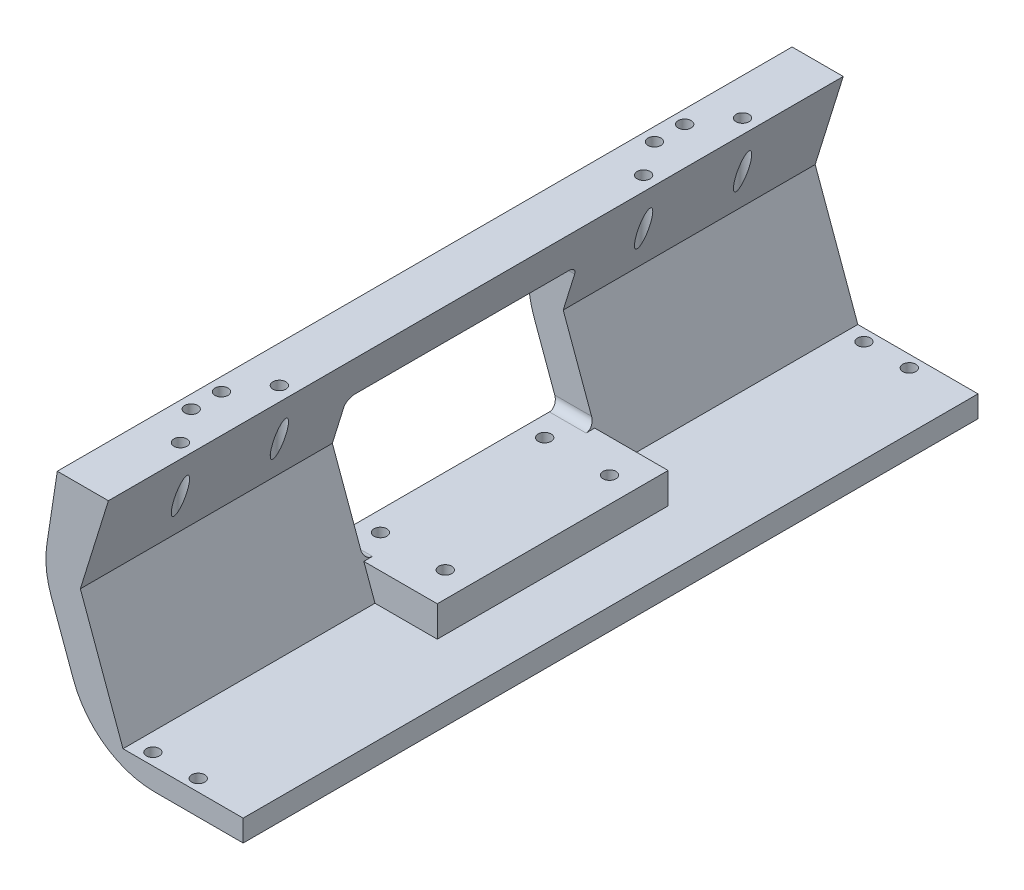
from build123d import *

# Parameters (mm, degrees)
SKETCH_1_W          = 27.799055089
SKETCH_1_H          = 170
SKETCH_1_R          = 1.5
EXTRUDE_1_DEPTH     = 5
EXTRUDE_2_DEPTH     = 170
FILLET_1_R          = 20
FILLET_2_R          = 20
SKETCH_3_R          = 1.5
CUT_EXTRUDE_1_DEPTH = 22
SKETCH_5_W          = 53.411136204
SKETCH_5_H          = 30.531921538
CUT_EXTRUDE_2_DEPTH = 138
SKETCH_6_W          = 16.9901426
SKETCH_6_H          = 53.411136204
EXTRUDE_3_DEPTH     = 7.098148729
FILLET_3_R          = 2
SKETCH_7_R          = 1.5
CUT_EXTRUDE_3_DEPTH = 20


with BuildPart() as part:
    # 草图1 → 凸台-拉伸1 (new body)
    with BuildSketch(Plane(origin=(0, 0, 0), x_dir=(1, 0, 0), z_dir=(0, 1, 0))):
        with Locations((91.881203353, 5)):
            Rectangle(SKETCH_1_W, SKETCH_1_H)
        with Locations(Location((82.140918425, 87.25, 0), (0, 0, 270))):
            Circle(SKETCH_1_R, mode=Mode.SUBTRACT)
        with Locations(Location((92.640918425, 87.25, 0), (0, 0, 270))):
            Circle(SKETCH_1_R, mode=Mode.SUBTRACT)
        with Locations(Location((82.140918425, -77.25, 0), (0, 0, 270))):
            Circle(SKETCH_1_R, mode=Mode.SUBTRACT)
        with Locations(Location((92.640918425, -77.25, 0), (0, 0, 270))):
            Circle(SKETCH_1_R, mode=Mode.SUBTRACT)
    extrude(amount=EXTRUDE_1_DEPTH)

    # 草图2 → 凸台-拉伸2 (add)
    with BuildSketch(Plane.XY.offset(80)):
        Polygon((70.154089187, 3.11568229), (59.601778844, 32.107916678), (60.432470808, 37.577633674), (62.77468262, 53), (74.6026601, 53), (68.115201024, 32.107916678), (77.981675808, 5), (77.981675808, 0), (71.288104799, 0), align=None)
    extrude(amount=-EXTRUDE_2_DEPTH)

    # 圆角1
    fillet_1_edges = [part.edges().sort_by_distance(p)[0] for p in [
        (59.601778844, 32.107916678, -5),
    ]]
    fillet(fillet_1_edges, radius=FILLET_1_R)

    # 圆角2
    # the kernel refuses this fillet: 20 mm, written as the material it takes off along each edge
    with BuildSketch(Plane(origin=(71.288104799, 0, 115.01037691), x_dir=(-0.34202014332567304, 0.9396926207859069, 0), z_dir=(0, 0, -1))) as fillet_2_piece_1:
        with BuildLine():
            CenterArc((FILLET_2_R * 0.70020753821, FILLET_2_R), FILLET_2_R, 200, 70)
            Line((-FILLET_2_R * 0.239485082576, FILLET_2_R * 0.657979856674), (0, 0))
            Line((0, 0), (FILLET_2_R * 0.70020753821, 0))
        make_face()
    extrude(amount=240.020753821, mode=Mode.SUBTRACT)

    # 草图3 → 切除-拉伸1 (cut)
    with BuildSketch(Plane(origin=(0, 53, 0), x_dir=(1, 0, 0), z_dir=(0, 1, 0))):
        with Locations(Location((71.288104799, 70.02483454, 0), (0, 0, 270))):
            Circle(SKETCH_3_R)
        with Locations(Location((65.841750728, 62.078973455, 0), (0, 0, 270))):
            Circle(SKETCH_3_R)
        with Locations(Location((65.841750728, 55.078973455, 0), (0, 0, 270))):
            Circle(SKETCH_3_R)
        with Locations(Location((71.288104799, 47.133112371, 0), (0, 0, 270))):
            Circle(SKETCH_3_R)
        with Locations(Location((71.288104799, -37.133112371, 0), (0, 0, 270))):
            Circle(SKETCH_3_R)
        with Locations(Location((65.841750728, -45.078973455, 0), (0, 0, 270))):
            Circle(SKETCH_3_R)
        with Locations(Location((65.841750728, -52.078973455, 0), (0, 0, 270))):
            Circle(SKETCH_3_R)
        with Locations(Location((71.288104799, -60.02483454, 0), (0, 0, 270))):
            Circle(SKETCH_3_R)
    extrude(amount=-CUT_EXTRUDE_1_DEPTH, mode=Mode.SUBTRACT)

    # 草图5 → 切除-拉伸2 (cut)
    with BuildSketch(Plane(origin=(0, 0, 0), x_dir=(0, 0, -1), z_dir=(1, 0, 0))):
        with Locations((5, 27.364109498)):
            Rectangle(SKETCH_5_W, SKETCH_5_H)
    extrude(amount=CUT_EXTRUDE_2_DEPTH, mode=Mode.SUBTRACT)

    # 草图6 → 凸台-拉伸3 (add)
    with BuildSketch(Plane(origin=(0, 5, 0), x_dir=(1, 0, 0), z_dir=(0, 1, 0))):
        with Locations((83.893232252, 5)):
            Rectangle(SKETCH_6_W, SKETCH_6_H)
    extrude(amount=EXTRUDE_3_DEPTH)

    # 圆角3
    fillet_3_edges = [part.edges().sort_by_distance(p)[0] for p in [
        (71.158795105, 12.098148729, -31.705568102),
        (71.158795105, 12.098148729, 21.705568102),
        (66.291177476, 42.630070267, 21.705568102),
        (66.291177476, 42.630070267, -31.705568102),
    ]]
    fillet(fillet_3_edges, radius=FILLET_3_R)

    # 草图7 → 切除-拉伸3 (cut)
    with BuildSketch(Plane(origin=(0, 12.098148729, 0), x_dir=(1, 0, 0), z_dir=(0, 1, 0))):
        with Locations(Location((71.530354556, -14, 0), (0, 0, 270))):
            Circle(SKETCH_7_R)
        with Locations(Location((71.530354556, 24, 0), (0, 0, 270))):
            Circle(SKETCH_7_R)
        with Locations(Location((86.530354556, 24, 0), (0, 0, 270))):
            Circle(SKETCH_7_R)
        with Locations(Location((86.530354556, -14, 0), (0, 0, 270))):
            Circle(SKETCH_7_R)
    extrude(amount=-CUT_EXTRUDE_3_DEPTH, mode=Mode.SUBTRACT)


solid = part.part
